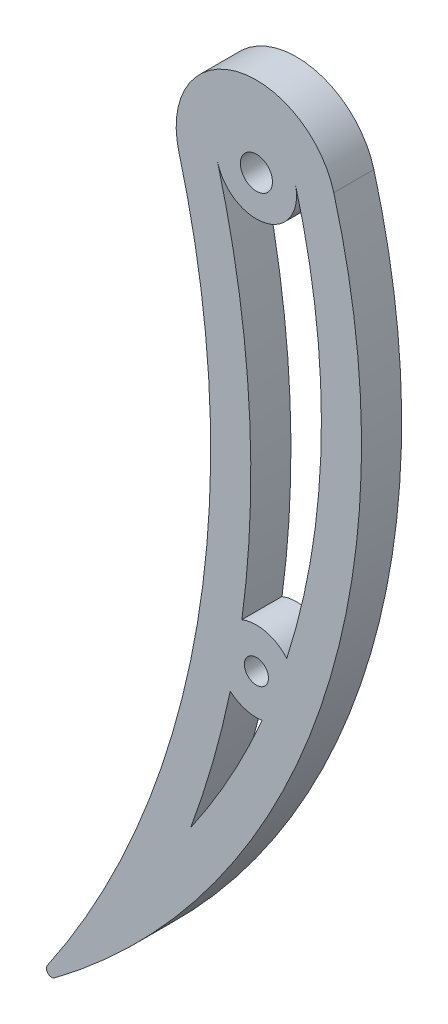
from build123d import *

# Parameters (mm, degrees)
SKETCH1_R           = 2
EXTRUDE1_DEPTH      = 5
CUT_EXTRUDE1_DEPTH  = 10
BOSS_EXTRUDE1_DEPTH = 5
CUT_EXTRUDE2_DEPTH  = 5


with BuildPart() as part:
    # Sketch1 → Extrude1 (new body)
    with BuildSketch(Plane.XY):
        with BuildLine():
            ThreePointArc((-26.085308936, -49.243272897), (-24.983078735, -55.562467556), (-18.568566007, -55.596511855))
            ThreePointArc((-18.568566007, -55.596511855), (9.955092257, -6.447651038), (9.831223687, 50.378348795))
            ThreePointArc((9.831223687, 50.378348795), (4.259504767, 53.557286163), (0.144535316, 48.6362374))
            ThreePointArc((0.144535316, 48.6362374), (0.489229737, -3.910438591), (-26.085308936, -49.243272897))
        make_face()
        with BuildLine():
            ThreePointArc((4.394388405, -6.462715876), (3.695668532, -4.775452102), (5.144535316, -3.6637626))
            ThreePointArc((5.144535316, -3.6637626), (6.5934021, -5.552073099), (4.394388405, -6.462715876))
        make_face(mode=Mode.SUBTRACT)
        with Locations((5.144535316, 48.6362374)):
            Circle(SKETCH1_R, mode=Mode.SUBTRACT)
        with Locations((-21.755464684, -51.7437626)):
            Circle(SKETCH1_R, mode=Mode.SUBTRACT)
    extrude(amount=EXTRUDE1_DEPTH)

    # Sketch3 → Cut-Extrude1 (cut)
    with BuildSketch(Plane(origin=(0, 0, 0), x_dir=(-1, 0, 0), z_dir=(0, 0, -1))):
        with BuildLine():
            ThreePointArc((26.085308936, -49.243272897), (16.272417408, -38.139391171), (8.225333931, -25.696181093))
            ThreePointArc((8.225333931, -25.696181093), (13.854681069, -38.186869472), (20.909608136, -49.931436277))
            ThreePointArc((20.909608136, -49.931436277), (22.829775371, -50.05679593), (23.755464684, -51.7437626))
            ThreePointArc((23.755464684, -51.7437626), (21.27804664, -53.685944881), (19.983392673, -50.816529735))
            ThreePointArc((19.983392673, -50.816529735), (8.408185994, -40.542939738), (-1.362976888, -28.540588427))
            ThreePointArc((-1.362976888, -28.540588427), (7.552683596, -42.842145312), (18.568566007, -55.596511855))
            ThreePointArc((18.568566007, -55.596511855), (24.983078735, -55.562467556), (26.085308936, -49.243272897))
        make_face()
    extrude(amount=-CUT_EXTRUDE1_DEPTH, mode=Mode.SUBTRACT)

    # Sketch3<3> → Boss-Extrude1 (add)
    with BuildSketch(Plane(origin=(0, 0, 0), x_dir=(-1, 0, 0), z_dir=(0, 0, -1))):
        with BuildLine():
            ThreePointArc((8.225333931, -25.696181093), (0.709764151, 9.885397236), (4.515866122, 46.052317111))
            ThreePointArc((4.515866122, 46.052317111), (-2.521867284, 58.28619141), (-14.783886482, 51.297610936))
            ThreePointArc((-14.783886482, 51.297610936), (-16.914814846, 9.892262753), (-1.362976888, -28.540588427))
            ThreePointArc((-1.362976888, -28.540588427), (-13.044605865, 10.119739731), (-9.831223687, 50.378348795))
            ThreePointArc((-9.831223687, 50.378348795), (-4.259504767, 53.557286163), (-0.144535316, 48.6362374))
            ThreePointArc((-0.144535316, 48.6362374), (-3.243862831, 10.649816422), (8.225333931, -25.696181093))
        make_face()
        with BuildLine():
            ThreePointArc((19.983392673, -50.816529735), (20.822206397, -50.767144538), (20.909608136, -49.931436277))
            ThreePointArc((20.909608136, -49.931436277), (20.37371395, -50.297814846), (19.983392673, -50.816529735))
        make_face()
    extrude(amount=-BOSS_EXTRUDE1_DEPTH)

    # Sketch4 → Cut-Extrude2 (cut)
    with BuildSketch(Plane(origin=(0, 0, 0), x_dir=(-1, 0, 0), z_dir=(0, 0, -1))):
        with BuildLine():
            ThreePointArc((-1.879022525, -8.950109944), (-3.738208311, -9.961912697), (-5.849425706, -10.11382619))
            ThreePointArc((-5.849425706, -10.11382619), (-1.805817512, -18.34494551), (3.046878131, -26.126554438))
            ThreePointArc((3.046878131, -26.126554438), (0.268148473, -17.628892121), (-1.879022525, -8.950109944))
        make_face()
        with BuildLine():
            ThreePointArc((-9.964210899, 49.966924168), (-13.222981584, 23.962412042), (-8.924214856, -1.890534442))
            ThreePointArc((-8.924214856, -1.890534442), (-6.34883687, -0.310963638), (-3.333762814, -0.503172193))
            ThreePointArc((-3.333762814, -0.503172193), (-4.204319589, 23.570760268), (-0.314334597, 47.344277255))
            ThreePointArc((-0.314334597, 47.344277255), (-6.455869332, 43.811260395), (-9.964210899, 49.966924168))
        make_face()
    extrude(amount=-CUT_EXTRUDE2_DEPTH, mode=Mode.SUBTRACT)


solid = part.part
